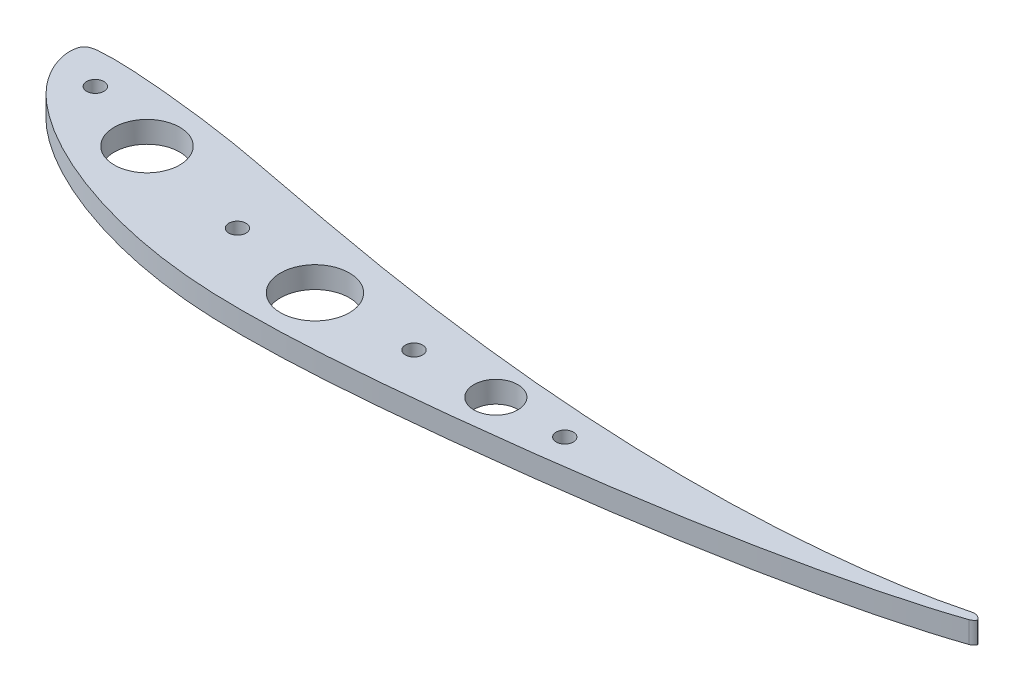
from build123d import *

# Parameters (mm, degrees)
BOSS_EXTRUDE1_DEPTH     = 6.35
CUT_EXTRUDE1_DEPTH      = 303.810310437
CUT_EXTRUDE1_DEPTH_BACK = 303.810310437
SKETCH2_W               = 393.802928686
SKETCH2_H               = 377.288612321
CUT_EXTRUDE2_DEPTH      = 283.415365435
CUT_EXTRUDE2_DEPTH_BACK = 283.415365435
SKETCH3_R               = 9.652
SKETCH3_R_2             = 6.477
SKETCH3_R_3             = 10.16
CUT_EXTRUDE3_DEPTH      = 283.415365435
CUT_EXTRUDE3_DEPTH_BACK = 283.415365435
SKETCH4_R               = 2.54
FILLET1_START           = -1
FILLET1_DEPTH           = 8


with BuildPart() as part:
    # Sketch1 → Boss-Extrude1 (new body)
    with BuildSketch(Plane(origin=(0, 0, 0), x_dir=(1, 0, 0), z_dir=(0, 1, 0))):
        with BuildLine():
            add(Edge.make_bspline(
                [(300, 0), (299.998164857, 0.00779164), (298.839344106, -0.779445448), (297.554109445, -1.557261733), (294.208506941, -3.567217026), (289.670511837, -5.741319387), (283.309862001, -8.117537748), (275.537544353, -10.344573143), (266.444933797, -12.426457704), (256.199580598, -14.259850291), (244.921593273, -15.783425097), (232.757799236, -16.95303584), (219.853005114, -17.723898038), (206.362388996, -18.086069393), (192.440424958, -18.031126951), (178.242435481, -17.563075992), (163.922450976, -16.707734217), (149.630087144, -15.499084227), (135.508778066, -13.96867228), (121.69193654, -12.185375966), (108.303825942, -10.2012163), (95.459843609, -8.089108753), (83.259652727, -5.919695474), (71.792874525, -3.774518778), (61.131558493, -1.742757161), (51.327830575, 0.124120628), (42.332755499, 1.612472911), (34.102555191, 2.676752338), (26.641186257, 3.506316053), (19.985024747, 4.119032645), (14.202184269, 4.500993922), (9.357001039, 4.708257182), (5.504292712, 4.571425014), (2.687991812, 4.430644029), (0.593636856, 3.433383365), (0.030806945, 1.425685769), (-0.064071838, -0.763170367), (0.432254203, -3.350986359), (1.472957172, -6.154515077), (3.096297331, -9.107117776), (5.293604421, -12.141886299), (8.1538869, -15.165147982), (11.663531794, -18.150717472), (15.771669221, -21.131215207), (20.476582832, -24.043436542), (25.748760324, -26.847906563), (31.559513587, -29.512722263), (37.890192116, -31.983746022), (44.701457062, -34.247740868), (51.964325815, -36.25171834), (59.648058967, -37.960151225), (67.744730542, -39.278158668), (76.256295795, -40.209302623), (85.217372344, -40.66715755), (94.631444177, -40.688826207), (104.481011399, -40.451416002), (114.71559881, -39.905988998), (125.27828836, -39.114555198), (136.108755034, -38.119239692), (147.130842995, -36.975880616), (158.254761127, -35.705837126), (169.388427347, -34.341090765), (180.442829375, -32.872036175), (191.337898087, -31.30338964), (202.003809914, -29.647576215), (212.371583338, -27.90139352), (222.381472324, -26.087301621), (231.970439683, -24.207909113), (241.08244638, -22.2863217), (249.661849638, -20.332420839), (257.657514291, -18.358409738), (265.023600127, -16.378574023), (271.719437297, -14.411083084), (277.707530364, -12.465173468), (282.956795386, -10.557733109), (287.442744548, -8.702232323), (291.15854786, -6.924488085), (294.146571526, -5.090376062), (296.330771837, -3.271289774), (298.182098042, -1.561384401), (299.015860339, -0.742755557), (300.001798578, -0.007636393), (300, 0)],
                knots=[0, 0, 0, 0, 0.000999594, 0.004147435, 0.009748209, 0.018044377, 0.028864178, 0.04183079, 0.056713807, 0.073341232, 0.091507989, 0.111021837, 0.131661709, 0.153207715, 0.175433402, 0.198110317, 0.221011446, 0.243905882, 0.266573311, 0.288810349, 0.310405036, 0.331177743, 0.350943876, 0.3695564, 0.386864963, 0.402753039, 0.417195876, 0.430379519, 0.442362633, 0.453032156, 0.462284346, 0.470026206, 0.476176645, 0.480649947, 0.483553073, 0.486420689, 0.489953231, 0.494096927, 0.498850588, 0.50419675, 0.510125492, 0.516691031, 0.524011699, 0.532092122, 0.540897921, 0.550403414, 0.560581041, 0.571396483, 0.582828081, 0.594829641, 0.607347037, 0.620384325, 0.633968937, 0.648199967, 0.663193937, 0.678898581, 0.695226562, 0.712113221, 0.729459406, 0.747143117, 0.765009772, 0.782904928, 0.800688045, 0.818242105, 0.835449083, 0.852211621, 0.868429578, 0.884009363, 0.898854951, 0.912881827, 0.92601075, 0.938166771, 0.949289699, 0.959322172, 0.968216949, 0.97594822, 0.982474409, 0.987904723, 0.992516501, 0.996351138, 0.999020322, 1, 1, 1, 1], degree=3))
        make_face()
    extrude(amount=BOSS_EXTRUDE1_DEPTH)

    # Sketch2 → Cut-Extrude1 (cut, two sides: drawn at the far end of the back side and taken through both)
    with BuildSketch(Plane(origin=(0, 6.35, 0), x_dir=(1, 0, 0), z_dir=(0, 1, 0)).offset(-CUT_EXTRUDE1_DEPTH_BACK)):
        with Locations((476.301464343, -22.754029618)):
            Rectangle(SKETCH2_W, SKETCH2_H)
    extrude(amount=CUT_EXTRUDE1_DEPTH + CUT_EXTRUDE1_DEPTH_BACK, mode=Mode.SUBTRACT)

    # Sketch3 → Cut-Extrude2 (cut, two sides: drawn at the far end of the back side and taken through both)
    with BuildSketch(Plane(origin=(0, 6.35, 0), x_dir=(1, 0, 0), z_dir=(0, 1, 0)).offset(-CUT_EXTRUDE2_DEPTH_BACK)):
        with Locations(Location((35.56, -12.7, 0), (0, 0, 270))):
            Circle(SKETCH3_R)
        with Locations(Location((151.13, -25.4, 0), (0, 0, 270))):
            Circle(SKETCH3_R_2)
        with Locations(Location((97.79, -25.4, 0), (0, 0, 270))):
            Circle(SKETCH3_R_3)
    extrude(amount=CUT_EXTRUDE2_DEPTH + CUT_EXTRUDE2_DEPTH_BACK, mode=Mode.SUBTRACT)

    # Sketch4 → Cut-Extrude3 (cut, two sides: drawn at the far end of the back side and taken through both)
    with BuildSketch(Plane(origin=(0, 6.35, 0), x_dir=(1, 0, 0), z_dir=(0, 1, 0)).offset(-CUT_EXTRUDE3_DEPTH_BACK)):
        with Locations(Location((12.7, -5.08, 0), (0, 0, 270))):
            Circle(SKETCH4_R)
        with Locations(Location((69.85, -20.32, 0), (0, 0, 270))):
            Circle(SKETCH4_R)
        with Locations(Location((127, -25.4, 0), (0, 0, 270))):
            Circle(SKETCH4_R)
        with Locations(Location((171.45, -25.4, 0), (0, 0, 270))):
            Circle(SKETCH4_R)
    extrude(amount=CUT_EXTRUDE3_DEPTH + CUT_EXTRUDE3_DEPTH_BACK, mode=Mode.SUBTRACT)

    # Fillet1: read off the stored shape, not the designer's step
    # Fillet1 outline → Fillet1 (cut)
    with BuildSketch(Plane(origin=(0, 0, 0), x_dir=(1, 0, 0), z_dir=(0, 1, 0)).offset(FILLET1_START)):
        with BuildLine():
            add(Edge.make_bspline(
                [(279.4, -9.214948088), (278.34234619, -9.518953955), (277.281383872, -9.808500086), (276.217017503, -10.087007974)],
                knots=[0.036055289, 0.036055289, 0.036055289, 0.036055289, 0.041312262, 0.041312262, 0.041312262, 0.041312262], degree=3))
            ThreePointArc((276.217017503, -10.087007974), (277.846954615, -10.203867151), (279.068386039, -11.289434438))
            ThreePointArc((279.068386039, -11.289434438), (278.481734309, -11.989477011), (277.6853853, -12.436744394))
            add(Edge.make_bspline(
                [(277.6853853, -12.436744394), (277.764168752, -12.409674219), (278.336643717, -12.212513322), (278.90807608, -12.012353104), (279.400000004, -11.837226434)],
                knots=[0.958924509, 0.958924509, 0.958924509, 0.958924509, 0.959322172, 0.961814814, 0.961814814, 0.961814814, 0.961814814], degree=3))
            Line((279.400000004, -11.837226434), (279.4, -9.214948088))
        make_face()
    extrude(amount=FILLET1_DEPTH, mode=Mode.SUBTRACT)


solid = part.part
